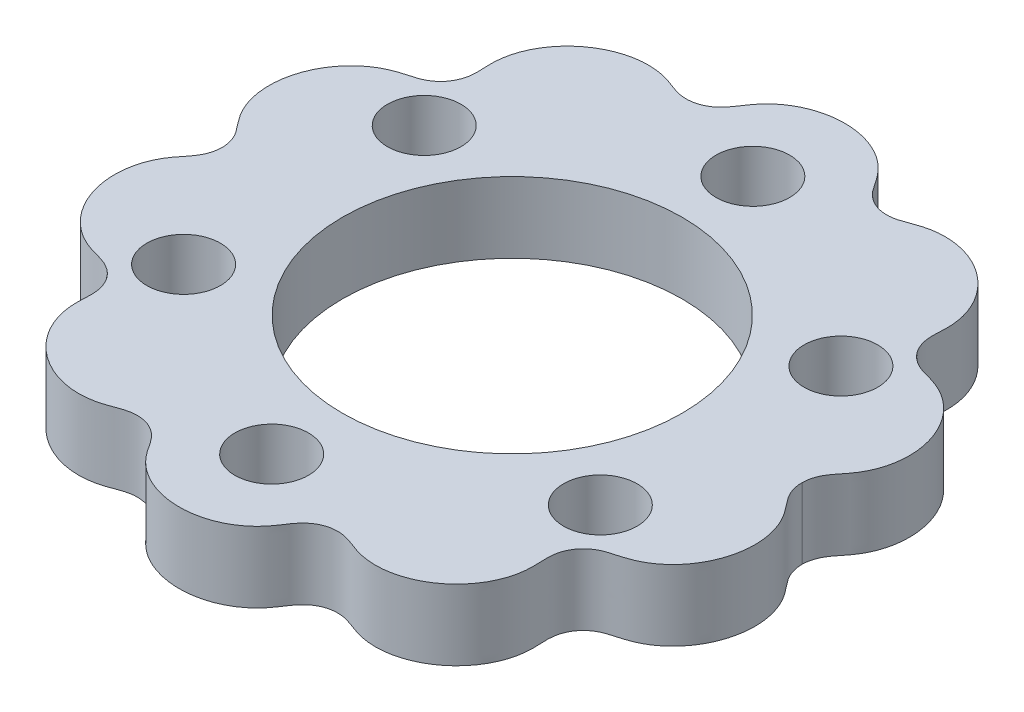
from build123d import *

# Parameters (mm, degrees)
BOSS_EXTRUDE1_OUTLINE_R = 12
BOSS_EXTRUDE1_DEPTH     = 5
SKETCH2_R               = 2.6
CUT_EXTRUDE1_DEPTH      = 34.029669098


# Read off the part's stored shape, not the designer's step: Boss-Extrude1
with BuildPart() as part:
    # Boss-Extrude1 outline → Boss-Extrude1 (new body)
    with BuildSketch(Plane(origin=(0, 0, 0), x_dir=(1, 0, 0), z_dir=(0, 1, 0))):
        with BuildLine():
            ThreePointArc((20.483482607, -0.022701294), (20.482946027, 0.00166963), (20.484024221, 0.026022605))
            add(Edge.make_bspline(
                [(20.484024221, 0.026022605), (20.487498074, 0.188449943), (20.530692051, 0.524452042), (20.676605138, 0.93985568), (20.802634755, 1.186739609), (20.961995806, 1.448332503), (21.103456977, 1.638126812), (21.23426835, 1.805069818), (21.341850471, 1.938204843), (21.465407288, 2.092648376), (21.599078875, 2.266000462), (21.740930616, 2.465610008), (21.913489756, 2.732637862), (22.102223597, 3.075517882), (22.289904471, 3.509157537), (22.437675662, 3.962561924), (22.544640092, 4.431900545), (22.631850119, 5.073155968), (22.635931659, 5.892477362), (22.474096644, 6.869523189), (22.151728016, 7.808025597), (21.679261622, 8.677237813), (21.173033912, 9.319065356), (20.710752428, 9.768857793), (20.338353665, 10.071217563), (19.943847721, 10.335367185), (19.598891474, 10.52192206), (19.311964608, 10.651672398), (19.091956237, 10.738997874), (18.861451659, 10.818617447), (18.613171389, 10.893641796), (18.375579531, 10.957979654), (18.124796572, 11.027363515), (17.87665533, 11.10397446), (17.555751292, 11.224627205), (17.173288608, 11.441745246), (16.81334335, 11.727777942), (16.47460098, 12.147137502), (16.187739874, 12.754018219), (16.110035958, 13.28670746), (16.101145961, 13.633535426), (16.108138063, 13.871526013), (16.117051473, 14.056213576), (16.12724693, 14.26170301), (16.135044653, 14.487223071), (16.134629824, 14.733331838), (16.12371617, 14.972608496), (16.094845812, 15.286098126), (16.031278198, 15.672776568), (15.910561477, 16.131316664), (15.691813887, 16.731029915), (15.314101069, 17.448746145), (14.712156044, 18.228522501), (13.983552914, 18.90049037), (13.152833257, 19.44286411), (12.247010156, 19.837678365), (11.454948784, 20.031636276), (10.815848468, 20.100832304), (10.337906347, 20.109066869), (9.866841828, 20.073375872), (9.479788087, 20.006734616), (9.173543214, 19.93146259), (8.941882381, 19.863101119), (8.699884696, 19.780888464), (8.478681878, 19.697619172), (8.25439962, 19.612950763), (8.039096318, 19.535005665), (7.722900473, 19.439995412), (7.246293364, 19.345266512), (6.602500608, 19.395481633), (6.089120799, 19.560365292), (5.672117431, 19.808452614), (5.305999577, 20.124285394), (5.078921017, 20.40391826), (4.920311032, 20.626432721), (4.809222169, 20.794669311), (4.689166945, 20.978745578), (4.562040932, 21.169532321), (4.416151439, 21.373141149), (4.268176964, 21.561900668), (4.113737202, 21.741360439), (3.898082894, 21.969212563), (3.608438394, 22.23456811), (3.228852964, 22.521898572), (2.684883678, 22.860294409), (1.943119792, 23.194262657), (0.987404123, 23.439533785), (-0.000909374, 23.52214198), (-0.989212315, 23.439776155), (-1.94492202, 23.194742468), (-2.686678182, 22.860918692), (-3.230573149, 22.522671486), (-3.610133163, 22.235409046), (-3.899718695, 21.970126207), (-4.115528168, 21.742131822), (-4.269891912, 21.562834171), (-4.417749348, 21.374133512), (-4.564935932, 21.169064813), (-4.691828328, 20.978831656), (-4.813775805, 20.792312909), (-4.9285933, 20.620152319), (-5.088480229, 20.396895814), (-5.336126588, 20.100397089), (-5.699324257, 19.799550244), (-5.997626627, 19.62917058), (-6.248701845, 19.523313061), (-6.445301067, 19.459719164), (-6.764166519, 19.390476705), (-7.295847059, 19.36359475), (-7.749251022, 19.460357959), (-8.056533891, 19.554607048), (-8.26732387, 19.631848292), (-8.488541821, 19.71597268), (-8.707472615, 19.798450199), (-8.949916333, 19.881059383), (-9.180488999, 19.949051155), (-9.487273251, 20.024561137), (-9.873745892, 20.091009534), (-10.345284348, 20.126848838), (-10.823029672, 20.118627653), (-11.462410445, 20.049501234), (-12.254502053, 19.855685927), (-13.160508382, 19.461037812), (-13.991355974, 18.918874917), (-14.72010821, 18.247088281), (-15.322164198, 17.467524749), (-15.699958999, 16.749923834), (-15.918725526, 16.150354971), (-16.039433209, 15.691967777), (-16.103025666, 15.305277448), (-16.131967956, 14.991400173), (-16.142813041, 14.753268659), (-16.143356335, 14.504075458), (-16.135728901, 14.280150498), (-16.125631177, 14.072159738), (-16.117023412, 13.883426319), (-16.11083046, 13.641049489), (-16.123194149, 13.281742738), (-16.210616111, 12.731348612), (-16.531307379, 12.106396429), (-16.876461466, 11.710246614), (-17.23191363, 11.441783492), (-17.602663362, 11.240760349), (-17.910777396, 11.127665395), (-18.15345477, 11.054023402), (-18.401200138, 10.98613142), (-18.637103225, 10.922480505), (-18.884171954, 10.848026153), (-19.114338146, 10.768473768), (-19.335001352, 10.680986047), (-19.620928799, 10.551687016), (-19.966514515, 10.364812301), (-20.360963807, 10.10073738), (-20.73345587, 9.798384102), (-21.195859728, 9.348594199), (-21.702289343, 8.706784186), (-22.174963713, 7.837648285), (-22.497573667, 6.899229098), (-22.659625381, 5.922227859), (-22.655723326, 5.103012062), (-22.568623752, 4.461874604), (-22.461695558, 3.992399748), (-22.314078359, 3.539257334), (-22.126420732, 3.105727935), (-21.937559919, 2.76250434), (-21.765038345, 2.495448791), (-21.623590088, 2.296437672), (-21.488037696, 2.120277827), (-21.364983314, 1.966235296), (-21.256446718, 1.830934938), (-21.12325584, 1.662051807), (-20.947084088, 1.414320874), (-20.730052707, 1.057488793), (-20.551889885, 0.508057622), (-20.495642746, -0.006716675), (-20.565308213, -0.539990923), (-20.7427851, -1.047747048), (-20.96166054, -1.410570845), (-21.133990458, -1.645993338), (-21.261320599, -1.808220095), (-21.373112148, -1.947174507), (-21.498886349, -2.103772464), (-21.628834979, -2.272146306), (-21.772382728, -2.474071811), (-21.945383477, -2.741516326), (-22.133866419, -3.083277665), (-22.321964262, -3.517419744), (-22.519348086, -4.1217213), (-22.663804547, -4.917131602), (-22.669181587, -5.90034295), (-22.507818085, -6.877432159), (-22.185890415, -7.816114934), (-21.713872281, -8.685523348), (-21.207879665, -9.327692846), (-20.745842213, -9.777721587), (-20.373678845, -10.080203164), (-19.979098621, -10.344699087), (-19.634142336, -10.531517143), (-19.34809271, -10.661039981), (-19.126596676, -10.74905869), (-18.898245912, -10.828140916), (-18.648093692, -10.90374931), (-18.413136582, -10.967488915), (-18.162538359, -11.036688557), (-17.915753006, -11.11264413), (-17.601165645, -11.230241123), (-17.221381245, -11.442162591), (-16.861455018, -11.724858114), (-16.524117768, -12.131326572), (-16.22182957, -12.753712395), (-16.144685056, -13.285541762), (-16.133835387, -13.637828722), (-16.141060037, -13.877721198), (-16.149787539, -14.062217568), (-16.16019465, -14.270631052), (-16.168002877, -14.493499317), (-16.167666042, -14.742323834), (-16.156987333, -14.980142613), (-16.128200855, -15.294027499), (-16.064814734, -15.681105277), (-15.944456467, -16.139231896), (-15.725947708, -16.739248893), (-15.348679721, -17.457034309), (-14.747080493, -18.237128225), (-14.018859948, -18.90940838), (-13.188331168, -19.452217306), (-12.282783761, -19.847437533), (-11.490660025, -20.041842483), (-10.851631739, -20.111351638), (-10.373888314, -20.119846093), (-9.901992595, -20.084315104), (-9.516253341, -20.018180006), (-9.208698685, -19.942680569), (-8.977914755, -19.874824001), (-8.735513258, -19.792443746), (-8.515356495, -19.709762142), (-8.291751142, -19.625252769), (-8.078229068, -19.547738441), (-7.764013451, -19.453006301), (-7.295517628, -19.357609564), (-6.658994059, -19.402395457), (-6.147955903, -19.558930623), (-5.716767949, -19.810404474), (-5.351972423, -20.121918206), (-5.114694003, -20.410127983), (-4.95652867, -20.632693371), (-4.844910234, -20.801207762), (-4.72352556, -20.987351176), (-4.597256762, -21.177135665), (-4.450523812, -21.381936069), (-4.302940537, -21.570547115), (-4.148824968, -21.749743242), (-3.932831667, -21.97819393), (-3.643599865, -22.243503457), (-3.26420682, -22.530988572), (-2.720315216, -22.869715999), (-1.978877367, -23.204007164), (-1.023205007, -23.449755929), (-0.034998943, -23.532834387), (0.953385274, -23.450944824), (1.909218798, -23.206366653), (2.651157415, -22.872926441), (3.195281181, -22.534921165), (3.575004237, -22.247855513), (3.864780118, -21.982697926), (4.080580064, -21.754961478), (4.235146448, -21.575574541), (4.383364651, -21.386759227), (4.52958094, -21.183026422), (4.657388338, -20.991671661), (4.778477435, -20.80665211), (4.891616962, -20.636296258), (5.05318951, -20.411400463), (5.2895029, -20.124674972), (5.670171566, -19.805588945), (6.102163404, -19.560784912), (6.617418296, -19.40905071), (7.248513585, -19.372393246), (7.707599519, -19.468686701), (8.017819808, -19.563345845), (8.229646925, -19.640814291), (8.452011927, -19.725236475), (8.672111972, -19.808388422), (8.913654508, -19.890667187), (9.145140951, -19.959144943), (9.451218584, -20.034578646), (9.838254152, -20.101448116), (10.309352302, -20.137430176), (10.787345748, -20.129494703), (11.426557479, -20.060710043), (12.21881439, -19.867282116), (13.12494663, -19.473101684), (13.956080959, -18.931324695), (14.685137401, -18.259904073), (15.287627114, -17.480579718), (15.665746416, -16.763241564), (15.884937301, -16.163515869), (16.005770547, -15.705691096), (16.069696005, -15.318160777), (16.098745746, -15.005230284), (16.109726547, -14.766380901), (16.110412094, -14.517999492), (16.102813183, -14.294635255), (16.092792288, -14.08562095), (16.084223338, -13.899743077), (16.077965172, -13.658940867), (16.088772752, -13.303478351), (16.175537787, -12.754686638), (16.481837124, -12.142258298), (16.827426222, -11.734921959), (17.184341375, -11.4619685), (17.557418624, -11.256453015), (17.871786663, -11.140301508), (18.115661281, -11.066065436), (18.364309166, -10.997844335), (18.600714136, -10.934163732), (18.848578676, -10.859498953), (19.078958077, -10.780099094), (19.298947221, -10.692942803), (19.585893834, -10.563387906), (19.931020704, -10.377004646), (20.325714947, -10.113080225), (20.698351125, -9.810923398), (21.16097529, -9.361394642), (21.667681891, -8.719879056), (22.140789663, -7.850974496), (22.46384259, -6.912709514), (22.626377889, -5.935796813), (22.622876121, -5.11654618), (22.536094667, -4.47524562), (22.429472071, -4.005954481), (22.281935534, -3.55237344), (22.094696366, -3.118949142), (21.905755073, -2.775298179), (21.733908871, -2.50898294), (21.59127144, -2.307998222), (21.458412683, -2.135319593), (21.333524864, -1.978894661), (21.226293899, -1.8454462), (21.092974261, -1.675207998), (20.919870428, -1.437566809), (20.722356441, -1.101733579), (20.594874319, -0.757362242), (20.508086725, -0.432992607), (20.483343284, -0.187278455), (20.483482607, -0.022701294)],
                knots=[0.076608735, 0.076608735, 0.076608735, 0.076608735, 0.077022241, 0.077435747, 0.077849252, 0.078262758, 0.079089769, 0.079916781, 0.080743792, 0.081570804, 0.083224826, 0.084878849, 0.086532872, 0.089840917, 0.093148962, 0.096457008, 0.099765053, 0.103073099, 0.10968919, 0.11630528, 0.122921371, 0.129537462, 0.136153553, 0.139461598, 0.142769644, 0.146077689, 0.149385734, 0.151039757, 0.15269378, 0.154347803, 0.156001825, 0.157655848, 0.158482859, 0.159309871, 0.160136882, 0.160550388, 0.160963893, 0.161377399, 0.161790905, 0.162617916, 0.163444927, 0.164271939, 0.16509895, 0.165925961, 0.167579984, 0.169234007, 0.17088803, 0.172542052, 0.175850098, 0.179158143, 0.182466189, 0.189082279, 0.19569837, 0.202314461, 0.208930552, 0.215546643, 0.222162733, 0.225470779, 0.228778824, 0.23208687, 0.235394915, 0.237048938, 0.23870296, 0.240356983, 0.242011006, 0.242838017, 0.243665029, 0.24449204, 0.245319051, 0.245732557, 0.246146063, 0.246559568, 0.246973074, 0.247800085, 0.248627097, 0.249454108, 0.250281119, 0.251935142, 0.253589165, 0.255243188, 0.25689721, 0.258551233, 0.261859278, 0.265167324, 0.268475369, 0.27509146, 0.281707551, 0.288323642, 0.294939732, 0.301555823, 0.308171914, 0.311479959, 0.314788005, 0.31809605, 0.319750073, 0.321404096, 0.323058118, 0.324712141, 0.326366164, 0.327193175, 0.328020187, 0.328847198, 0.329674209, 0.330087715, 0.330429401, 0.330532778, 0.330739531, 0.330914726, 0.331328232, 0.332155243, 0.332982255, 0.333809266, 0.334636277, 0.3362903, 0.337944323, 0.339598345, 0.341252368, 0.344560414, 0.347868459, 0.351176504, 0.35448455, 0.361100641, 0.367716731, 0.374332822, 0.380948913, 0.387565004, 0.394181095, 0.39748914, 0.400797186, 0.404105231, 0.405759254, 0.407413276, 0.409067299, 0.410721322, 0.411548333, 0.412375344, 0.413202356, 0.414029367, 0.414856379, 0.415269884, 0.41568339, 0.416096896, 0.416510401, 0.417337413, 0.418164424, 0.418991435, 0.420645458, 0.422299481, 0.423953503, 0.425607526, 0.427261549, 0.430569594, 0.43387764, 0.437185685, 0.44049373, 0.447109821, 0.453725912, 0.460342003, 0.466958094, 0.473574185, 0.47688223, 0.480190275, 0.483498321, 0.486806366, 0.490114412, 0.491768434, 0.493422457, 0.49507648, 0.495903491, 0.496730502, 0.497557514, 0.498384525, 0.499211536, 0.499625042, 0.500038548, 0.500452054, 0.500865559, 0.501692571, 0.502519582, 0.503346593, 0.504173605, 0.505000616, 0.506654639, 0.508308661, 0.509962684, 0.513270729, 0.516578775, 0.51988682, 0.526502911, 0.533119002, 0.539735093, 0.546351184, 0.552967274, 0.559583365, 0.562891411, 0.566199456, 0.569507501, 0.572815547, 0.57446957, 0.576123592, 0.577777615, 0.579431638, 0.58108566, 0.581912672, 0.582739683, 0.583566694, 0.5839802, 0.584393706, 0.584807211, 0.585220717, 0.586047728, 0.58687474, 0.587701751, 0.588528763, 0.589355774, 0.591009797, 0.592663819, 0.594317842, 0.595971865, 0.59927991, 0.602587956, 0.605896001, 0.612512092, 0.619128183, 0.625744273, 0.632360364, 0.638976455, 0.645592546, 0.648900591, 0.652208637, 0.655516682, 0.658824728, 0.66047875, 0.662132773, 0.663786796, 0.665440818, 0.66626783, 0.667094841, 0.667921852, 0.668748864, 0.669162369, 0.669575875, 0.669989381, 0.670402886, 0.671229898, 0.672056909, 0.67288392, 0.673710932, 0.675364955, 0.677018977, 0.678673, 0.680327023, 0.681981045, 0.685289091, 0.688597136, 0.691905182, 0.698521272, 0.705137363, 0.711753454, 0.718369545, 0.724985636, 0.731601727, 0.734909772, 0.738217817, 0.741525863, 0.743179885, 0.744833908, 0.746487931, 0.748141954, 0.749795976, 0.750622988, 0.751449999, 0.75227701, 0.753104022, 0.753517527, 0.753931033, 0.754344539, 0.754758044, 0.755585056, 0.756412067, 0.757239078, 0.75806609, 0.759720112, 0.761374135, 0.763028158, 0.764682181, 0.767990226, 0.771298271, 0.774606317, 0.777914362, 0.784530453, 0.791146544, 0.797762635, 0.804378726, 0.810994816, 0.817610907, 0.820918953, 0.824226998, 0.827535043, 0.829189066, 0.830843089, 0.832497112, 0.834151134, 0.834978146, 0.835805157, 0.836632168, 0.83745918, 0.838286191, 0.838699697, 0.839113202, 0.839526708, 0.839940214, 0.840767225, 0.841594236, 0.842421248, 0.84407527, 0.845729293, 0.847383316, 0.849037339, 0.850691361, 0.853999407, 0.857307452, 0.860615497, 0.863923543, 0.870539634, 0.877155725, 0.883771815, 0.890387906, 0.897003997, 0.900312042, 0.903620088, 0.906928133, 0.910236179, 0.913544224, 0.915198247, 0.916852269, 0.918506292, 0.919333304, 0.920160315, 0.920987326, 0.921814338, 0.922641349, 0.922848102, 0.923054855, 0.92346836, 0.92346836, 0.92346836, 0.92346836], degree=3))
        make_face()
        Circle(BOSS_EXTRUDE1_OUTLINE_R, mode=Mode.SUBTRACT)
    extrude(amount=BOSS_EXTRUDE1_DEPTH)

    # Sketch2 → Cut-Extrude1 (cut, through all)
    with BuildSketch(Plane(origin=(0, 5, 0), x_dir=(1, 0, 0), z_dir=(0, 1, 0))):
        with Locations(Location((0, 17, 0), (0, 0, 270))):
            Circle(SKETCH2_R)
        with Locations(Location((14.722431864, 8.5, 0), (0, 0, 270))):
            Circle(SKETCH2_R)
        with Locations(Location((14.722431864, -8.5, 0), (0, 0, 270))):
            Circle(SKETCH2_R)
        with Locations(Location((0, -17, 0), (0, 0, 270))):
            Circle(SKETCH2_R)
        with Locations(Location((-14.722431864, -8.5, 0), (0, 0, 270))):
            Circle(SKETCH2_R)
        with Locations(Location((-14.722431864, 8.5, 0), (0, 0, 270))):
            Circle(SKETCH2_R)
    extrude(amount=-CUT_EXTRUDE1_DEPTH, mode=Mode.SUBTRACT)


solid = part.part
